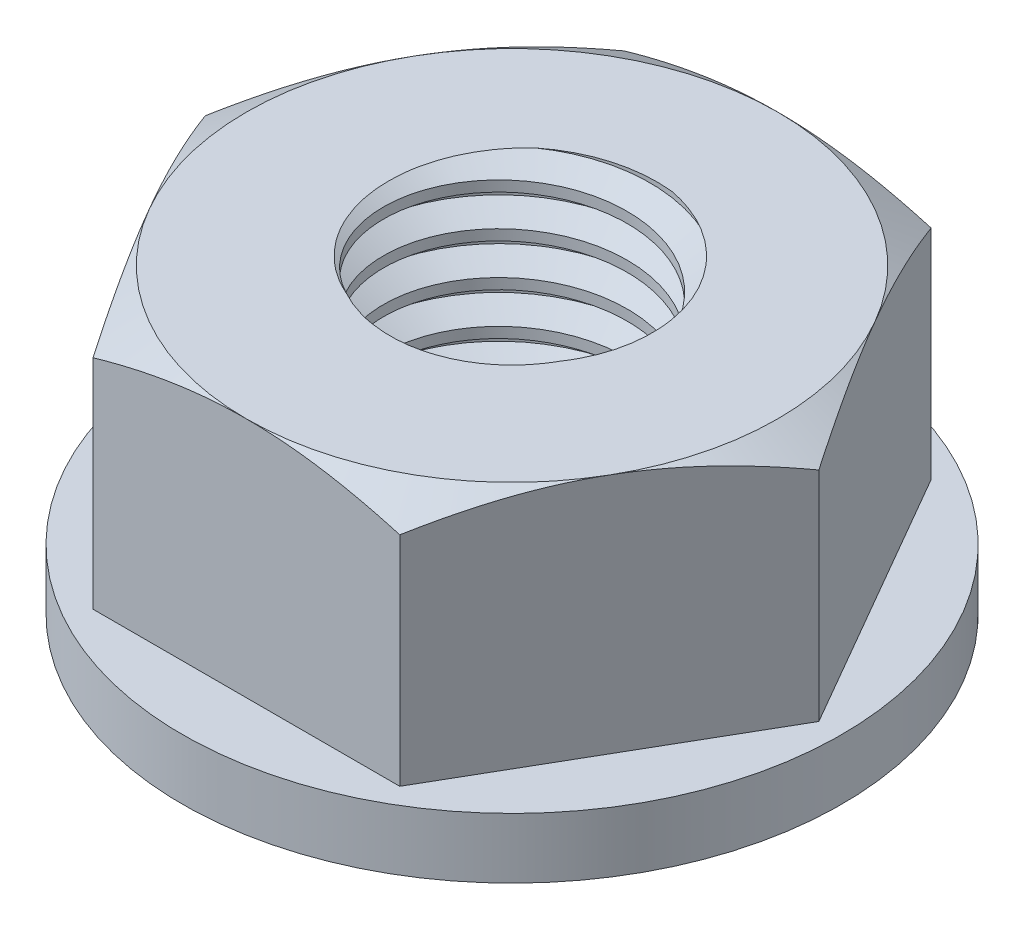
from build123d import *

# Parameters (mm, degrees)
BOSS_EXTRUDE1_DEPTH = 10
SKETCH2_R           = 6
CUT_EXTRUDE1_DEPTH  = 20.553345835
SKETCH3_OUTSIDE_W   = 69.058
SKETCH3_OUTSIDE_H   = 65.654
SKETCH3_OUTSIDE_R   = 11
CUT_EXTRUDE2_DEPTH  = 10
CUT_EXTRUDE2_DRAFT  = -60
THREAD2_PITCH       = 1.75
SKETCH12_W          = 22.346300659
SKETCH12_H          = 2.758245698
SKETCH12_W_2        = 23.634526935
SKETCH12_H_2        = 3.220714837
CUT_EXTRUDE3_DEPTH  = 29.09515082
SKETCH13_R          = 13.645170482
BOSS_EXTRUDE2_DEPTH = 2.5
SKETCH14_R          = 5
CUT_EXTRUDE4_DEPTH  = 23.99198458


with BuildPart() as part:
    # Sketch1 → Boss-Extrude1 (new body)
    with BuildSketch(Plane(origin=(0, 0, 0), x_dir=(1, 0, 0), z_dir=(0, 1, 0))):
        Polygon((12.701705922, 0), (6.350852961, 11), (-6.350852961, 11), (-12.701705922, 0), (-6.350852961, -11), (6.350852961, -11), align=None)
    extrude(amount=BOSS_EXTRUDE1_DEPTH)

    # Sketch2 → Cut-Extrude1 (cut, through all)
    with BuildSketch(Plane(origin=(0, 10, 0), x_dir=(1, 0, 0), z_dir=(0, 1, 0))):
        with Locations(Location((0, 0, 0), (0, 0, 270))):
            Circle(SKETCH2_R)
    extrude(amount=-CUT_EXTRUDE1_DEPTH, mode=Mode.SUBTRACT)


with BuildPart() as cut_extrude2_tool:
    # Sketch3 outside → Cut-Extrude2 (with draft: the straight prism first)
    with BuildSketch(Plane(origin=(0, 10, 0), x_dir=(1, 0, 0), z_dir=(0, 1, 0))):
        Rectangle(SKETCH3_OUTSIDE_W, SKETCH3_OUTSIDE_H)
        Circle(SKETCH3_OUTSIDE_R, mode=Mode.SUBTRACT)
    extrude(amount=-CUT_EXTRUDE2_DEPTH)
    # Cut-Extrude2: the draft: its side faces are tilted about the plane it starts from
    cut_extrude2_sides = [cut_extrude2_tool.faces().sort_by_distance(p)[0] for p in [
        (0, 5, 32.827),
        (34.529, 5, 0),
        (0, 5, -32.827),
        (-34.529, 5, 0),
        (-11, 5, 0),
    ]]
    draft(cut_extrude2_sides, Plane(origin=(0, 10, 0), x_dir=(1, 0, 0), z_dir=(0, 1, 0)), CUT_EXTRUDE2_DRAFT)


with BuildPart() as part_1:
    add(part.part)

    # Cut-Extrude2: cut by cut_extrude2_tool
    add(cut_extrude2_tool.part, mode=Mode.SUBTRACT)

    # Thread2: the profile of Thread Profile2 profile screwed along a right-hand helix of 6.857143 turns, 10 arcs to a turn; built about Z, then put on its axis
    thread2_z = Axis((0, 0, 0), (0, 0, 1))
    thread2_corners = [(6.0003, 0, -0.000173205), (6.0003, 0, 1.5314232), (5.052784719, 0, 0.984374998), (5.052784719, 0, 0.546874998)]
    with BuildLine(mode=Mode.PRIVATE) as thread2_profile:
        Line(thread2_corners[0], thread2_corners[1])
        Line(thread2_corners[1], thread2_corners[2])
        Line(thread2_corners[2], thread2_corners[3])
        Line(thread2_corners[3], thread2_corners[0])
    thread2_cap = Face(thread2_profile.wire())
    thread2_turn_angles = [0, 18, 36, 54, 72, 90, 108, 126, 144, 162, 180, 198, 216, 234, 252, 270, 288, 306, 324, 342, 360]
    thread2_turn_weights = [1, 0.9510565162951535, 1, 0.9510565162951535, 1, 0.9510565162951535, 1, 0.9510565162951535, 1, 0.9510565162951535, 1, 0.9510565162951535, 1, 0.9510565162951535, 1, 0.9510565162951535, 1, 0.9510565162951535, 1, 0.9510565162951535, 1]
    thread2_turn_rails = [Edge.make_bspline([Vector(p[0], p[1], 0).rotate(thread2_z, thread2_turn_angles[k]) / thread2_turn_weights[k] + Vector(0, 0, p[2] + THREAD2_PITCH * thread2_turn_angles[k] / 360) for k in range(21)], [0, 0, 0, 1, 1, 2, 2, 3, 3, 4, 4, 5, 5, 6, 6, 7, 7, 8, 8, 9, 9, 10, 10, 10], 2, thread2_turn_weights) for p in thread2_corners]
    thread2_turn_sides = [Face.make_surface_from_curves(thread2_turn_rails[p[0]], thread2_turn_rails[p[1]]) for p in [(0, 1), (1, 2), (2, 3), (3, 0)]]
    thread2_last_angles = [2160, 2178, 2196, 2214, 2232, 2250, 2268, 2286, 2304, 2322, 2340, 2358, 2376, 2394, 2412, 2430, 2448, 2458.285714286, 2468.571428571]
    thread2_last_weights = [1, 0.9510565162951535, 1, 0.9510565162951535, 1, 0.9510565162951535, 1, 0.9510565162951535, 1, 0.9510565162951535, 1, 0.9510565162951535, 1, 0.9510565162951535, 1, 0.9510565162951535, 1, 0.9839295885986299, 1]
    thread2_last_rails = [Edge.make_bspline([Vector(p[0], p[1], 0).rotate(thread2_z, thread2_last_angles[k]) / thread2_last_weights[k] + Vector(0, 0, p[2] + THREAD2_PITCH * thread2_last_angles[k] / 360) for k in range(19)], [0, 0, 0, 1, 1, 2, 2, 3, 3, 4, 4, 5, 5, 6, 6, 7, 7, 8, 8, 9, 9, 9], 2, thread2_last_weights) for p in thread2_corners]
    thread2_last_sides = [Face.make_surface_from_curves(thread2_last_rails[p[0]], thread2_last_rails[p[1]]) for p in [(0, 1), (1, 2), (2, 3), (3, 0)]]
    thread2 = Plane(origin=(0, 12, 0), x_dir=(-1, 0, 0), z_dir=(0, -1, 0)) * Solid(Shell([*[p.moved(Location((0, 0, THREAD2_PITCH * i))) for i in range(6) for p in thread2_turn_sides], *thread2_last_sides, thread2_cap, thread2_cap.rotate(thread2_z, 2468.571428571).moved(Location((0, 0, THREAD2_PITCH * 2468.571428571 / 360)))]))
    add(thread2)

    # Sketch12 → Cut-Extrude3 (cut, through all)
    with BuildSketch(Plane.XY.offset(11)):
        with Locations((0.17315033, 11.379122849)):
            Rectangle(SKETCH12_W, SKETCH12_H)
        with Locations((0.817263468, -1.610357419)):
            Rectangle(SKETCH12_W_2, SKETCH12_H_2)
    extrude(amount=-CUT_EXTRUDE3_DEPTH, mode=Mode.SUBTRACT)

    # Sketch13 → Boss-Extrude2 (add)
    with BuildSketch(Plane.XZ):
        with Locations(Location((0, 0, 0), (0, 0, 270))):
            Circle(SKETCH13_R)
    extrude(amount=BOSS_EXTRUDE2_DEPTH)

    # Sketch14 → Cut-Extrude4 (cut, through all)
    with BuildSketch(Plane(origin=(0, 10, 0), x_dir=(1, 0, 0), z_dir=(0, 1, 0))):
        with Locations(Location((0, 0, 0), (0, 0, 270))):
            Circle(SKETCH14_R)
    extrude(amount=-CUT_EXTRUDE4_DEPTH, mode=Mode.SUBTRACT)


solid = part_1.part
